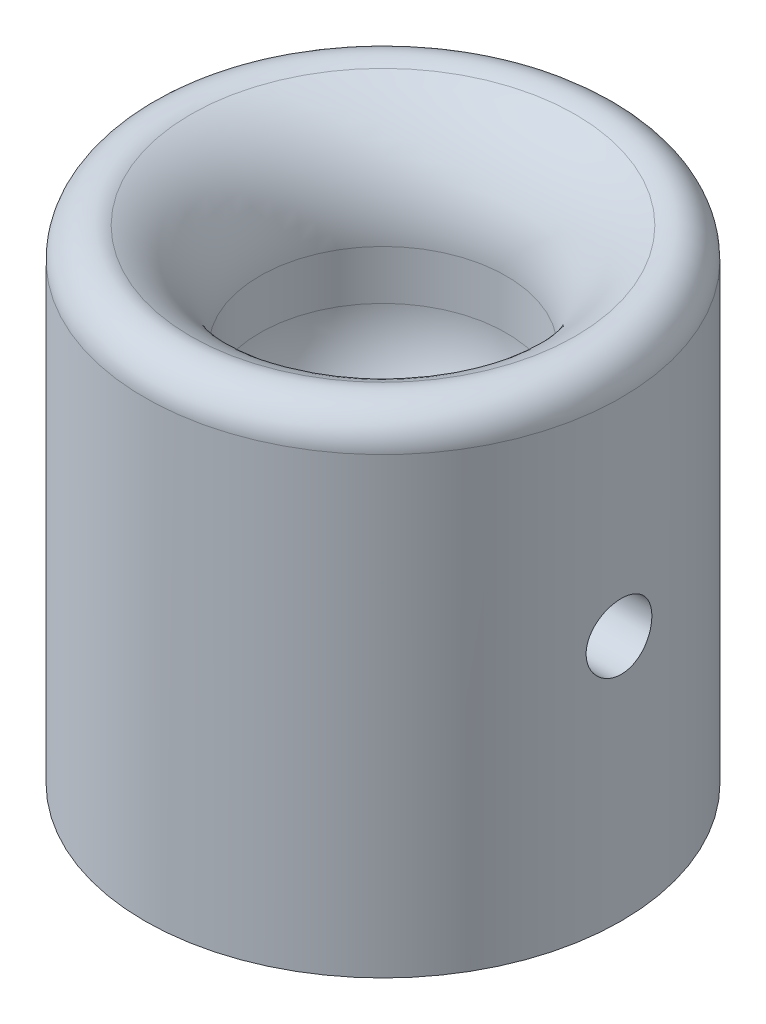
from build123d import *

# Parameters (mm, degrees)
ESBO_O1_R                  = 14.5
RESSALTO_EXTRUS_O1_DEPTH   = 30
ESBO_O3_R                  = 7.5
CORTE_EXTRUS_O3_DEPTH      = 17
FILETE1_R                  = 7
FILETE2_R                  = 2
CORTE_EXTRUS_O1_DEPTH      = 36.994872408
CORTE_EXTRUS_O1_DEPTH_BACK = 36.994872408
ESBO_O2_R                  = 2
ESBO_O1_3_R                = 2
CORTE_EXTRUS_O2_DEPTH      = 10


with BuildPart() as part:
    # Esboço1 → Ressalto-extrusão1 (new body)
    with BuildSketch(Plane(origin=(0, 0, 0), x_dir=(1, 0, 0), z_dir=(0, 1, 0))):
        with Locations(Location((0, 0, 0), (0, 0, 270))):
            Circle(ESBO_O1_R)
    extrude(amount=RESSALTO_EXTRUS_O1_DEPTH)

    # Esboço3 → Corte-extrusão3 (cut)
    with BuildSketch(Plane(origin=(0, 30, 0), x_dir=(1, 0, 0), z_dir=(0, 1, 0))):
        with Locations(Location((0, 0, 0), (0, 0, 270))):
            Circle(ESBO_O3_R)
    extrude(amount=-CORTE_EXTRUS_O3_DEPTH, mode=Mode.SUBTRACT)

    # Filete1
    filete1_edges = [part.edges().sort_by_distance(p)[0] for p in [
        (0, 13, -7.5),
        (0, 30, -7.5),
    ]]
    fillet(filete1_edges, radius=FILETE1_R - 0.0001)  # a hair under: the kernel refuses the full size

    # Filete2
    filete2_edges = [part.edges().sort_by_distance(p)[0] for p in [
        (0, 30, -14.5),
    ]]
    fillet(filete2_edges, radius=FILETE2_R)

    # Esboço2 → Corte-extrusão1 (cut, two sides: drawn at the far end of the back side and taken through both)
    with BuildSketch(Plane(origin=(0, 0, 0), x_dir=(0, 0, -1), z_dir=(1, 0, 0)).offset(-CORTE_EXTRUS_O1_DEPTH_BACK)):
        with Locations((0, 15)):
            Circle(ESBO_O2_R)
    extrude(amount=CORTE_EXTRUS_O1_DEPTH + CORTE_EXTRUS_O1_DEPTH_BACK, mode=Mode.SUBTRACT)

    # Esboço1<3> → Corte-extrusão2 (cut)
    with BuildSketch(Plane(origin=(0, 0, 0), x_dir=(1, 0, 0), z_dir=(0, 1, 0))):
        with Locations(Location((-7.25, 0, 0), (0, 0, 270))):
            Circle(ESBO_O1_3_R)
        with BuildLine():
            ThreePointArc((3.175, 0), (2.24506403, 2.24506403), (0, 3.175))
            Line((0, 3.175), (0, -3.175))
            ThreePointArc((0, -3.175), (2.24506403, -2.24506403), (3.175, 0))
        make_face()
        with BuildLine():
            Line((0, -3.175), (0, 3.175))
            ThreePointArc((0, 3.175), (-3.175, 0), (0, -3.175))
        make_face()
        with Locations(Location((7.25, 0, 0), (0, 0, 270))):
            Circle(ESBO_O1_3_R)
    extrude(amount=CORTE_EXTRUS_O2_DEPTH, mode=Mode.SUBTRACT)


solid = part.part
